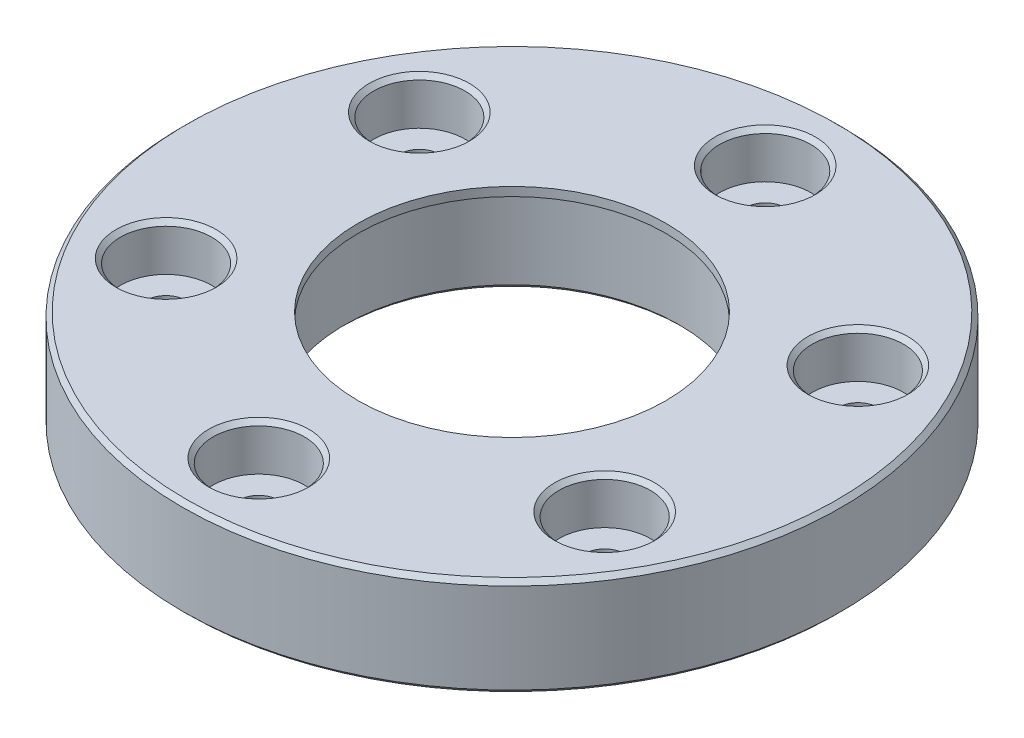
from build123d import *

# Parameters (mm, degrees)
SKETCH_1_R          = 15
SKETCH_1_R_2        = 7
SKETCH_1_R_3        = 2.08
EXTRUDE_1_DEPTH     = 2.1
EXTRUDE_START       = 2.4
SKETCH_2_R          = 15
SKETCH_2_R_2        = 7
SKETCH_2_R_3        = 0.9
EXTRUDE_2_DEPTH     = 2.4
SKETCH_3_R          = 7.6
CUT_EXTRUDE_1_DEPTH = 4.1
CHAMFER_1_SIZE      = 0.2
CHAMFER_2_SIZE      = 0.3


with BuildPart() as part:
    # 草图1 → 凸台-拉伸1 (new body)
    with BuildSketch(Plane(origin=(0, 0, 0), x_dir=(1, 0, 0), z_dir=(0, 1, 0))):
        Circle(SKETCH_1_R)
        Circle(SKETCH_1_R_2, mode=Mode.SUBTRACT)
        with Locations((0, 11.525)):
            Circle(SKETCH_1_R_3, mode=Mode.SUBTRACT)
        with Locations((9.980942779, 5.7625)):
            Circle(SKETCH_1_R_3, mode=Mode.SUBTRACT)
        with Locations((9.980942779, -5.7625)):
            Circle(SKETCH_1_R_3, mode=Mode.SUBTRACT)
        with Locations((0, -11.525)):
            Circle(SKETCH_1_R_3, mode=Mode.SUBTRACT)
        with Locations((-9.980942779, -5.7625)):
            Circle(SKETCH_1_R_3, mode=Mode.SUBTRACT)
        with Locations((-9.980942779, 5.7625)):
            Circle(SKETCH_1_R_3, mode=Mode.SUBTRACT)
    extrude(amount=EXTRUDE_1_DEPTH)

    # 草图2 → 凸台-拉伸2 (add)
    with BuildSketch(Plane(origin=(0, 0, 0), x_dir=(-1, 0, 0), z_dir=(0, -1, 0)).offset(EXTRUDE_START)):
        Circle(SKETCH_2_R)
        Circle(SKETCH_2_R_2, mode=Mode.SUBTRACT)
        with Locations((0, 11.53)):
            Circle(SKETCH_2_R_3, mode=Mode.SUBTRACT)
        with Locations((9.985272906, 5.765)):
            Circle(SKETCH_2_R_3, mode=Mode.SUBTRACT)
        with Locations((9.985272906, -5.765)):
            Circle(SKETCH_2_R_3, mode=Mode.SUBTRACT)
        with Locations((0, -11.53)):
            Circle(SKETCH_2_R_3, mode=Mode.SUBTRACT)
        with Locations((-9.985272906, -5.765)):
            Circle(SKETCH_2_R_3, mode=Mode.SUBTRACT)
        with Locations((-9.985272906, 5.765)):
            Circle(SKETCH_2_R_3, mode=Mode.SUBTRACT)
    extrude(amount=-EXTRUDE_2_DEPTH)

    # 草图3 → 切除-拉伸1 (cut)
    with BuildSketch(Plane(origin=(0, -2.4, 0), x_dir=(-1, 0, 0), z_dir=(0, -1, 0))):
        Circle(SKETCH_3_R)
    extrude(amount=-CUT_EXTRUDE_1_DEPTH, mode=Mode.SUBTRACT)

    # 倒角1
    chamfer_1_edges = [part.edges().sort_by_distance(p)[0] for p in [
        (15, -2.4, 0),
        (-12.060942779, 2.1, -5.7625),
        (-2.08, 2.1, 11.525),
        (7.900942779, 2.1, -5.7625),
        (-15, 2.1, 0),
        (-2.08, 2.1, -11.525),
        (7.900942779, 2.1, 5.7625),
        (-12.060942779, 2.1, 5.7625),
        (10.885272906, -2.4, -5.765),
        (0.9, -2.4, 11.53),
        (-9.085272906, -2.4, -5.765),
        (0.9, -2.4, -11.53),
        (-9.085272906, -2.4, 5.765),
        (10.885272906, -2.4, 5.765),
        (7.6, -2.4, 0),
    ]]
    chamfer(chamfer_1_edges, length=CHAMFER_1_SIZE)

    # 倒角2
    chamfer_2_edges = [part.edges().sort_by_distance(p)[0] for p in [
        (7.6, 1.7, 0),
    ]]
    chamfer(chamfer_2_edges, length=CHAMFER_2_SIZE)


solid = part.part
